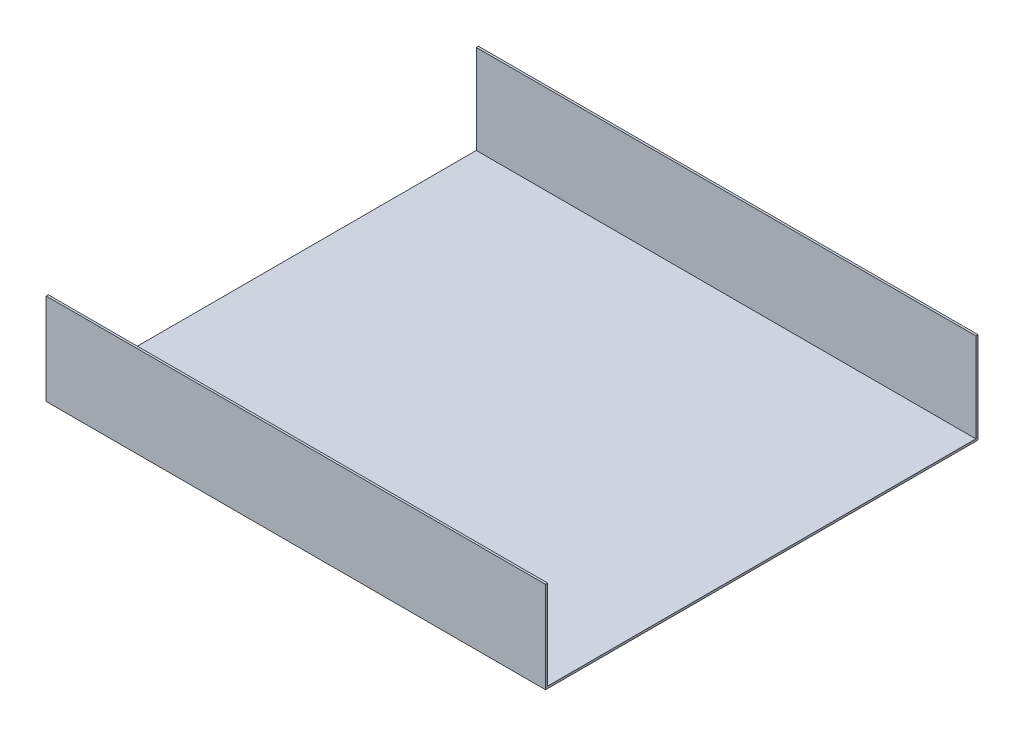
from build123d import *

# Parameters (mm, degrees)
CROQUIS1_W              = 120
CROQUIS1_H              = 25
SALIENTE_EXTRUIR1_DEPTH = 140
VACIADO1_T              = 0.6


with BuildPart() as part:
    # Croquis1 → Saliente-Extruir1 (new body)
    with BuildSketch(Plane(origin=(0, 0, 0), x_dir=(0, 0, -1), z_dir=(1, 0, 0))):
        with Locations((60, 12.5)):
            Rectangle(CROQUIS1_W, CROQUIS1_H)
    extrude(amount=SALIENTE_EXTRUIR1_DEPTH)

    # Vaciado1
    vaciado1_openings = [part.faces().sort_by_distance(p)[0] for p in [
        (0, 12.5, -60),
        (140, 12.5, -60),
        (70, 25, -60),
    ]]
    offset(amount=VACIADO1_T, openings=vaciado1_openings, kind=Kind.INTERSECTION)


solid = part.part
